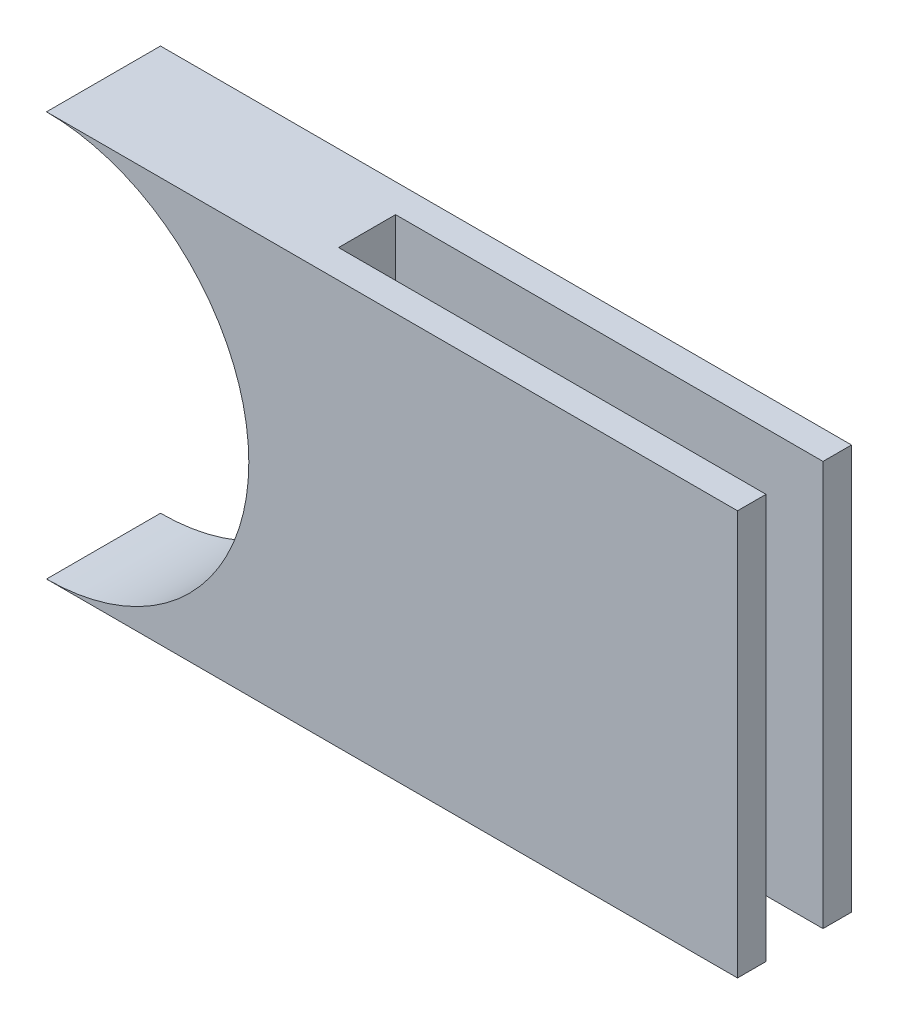
from build123d import *

# Parameters (mm, degrees)
SKETCH1_R               = 19.939
CIRCLE_EXTRUDE_DEPTH    = 7.62
SKETCH3_W               = 7.62
SKETCH3_H               = 39.878
RECTANGLE_EXTRUDE_DEPTH = 63.5
SKETCH2_R               = 18.034
CRICLE_CUT_DEPTH        = 67.991627245
SKETCH4_OUTSIDE_W       = 103.997
SKETCH4_OUTSIDE_H       = 60.436
SKETCH4_OUTSIDE_W_2     = 61.595
SKETCH4_OUTSIDE_H_2     = 36.068
FRAME_CUT_DEPTH         = 67.991627245
EXTENSION_DEPTH         = 2.54
SKETCH13_W              = 5.08
SKETCH13_H              = 36.068
CUT_EXTRUDE1_DEPTH      = 38.1
SKETCH14_R              = 1.905
BOSS_EXTRUDE3_DEPTH     = 2.54


with BuildPart() as part:
    # Sketch1 → circle extrude (new body)
    with BuildSketch(Plane.XY):
        Circle(SKETCH1_R)
    extrude(amount=CIRCLE_EXTRUDE_DEPTH)

    # Sketch3 → rectangle extrude (add)
    with BuildSketch(Plane(origin=(0, 0, 0), x_dir=(0, 0, -1), z_dir=(1, 0, 0))):
        with Locations((-3.81, 0)):
            Rectangle(SKETCH3_W, SKETCH3_H)
    extrude(amount=RECTANGLE_EXTRUDE_DEPTH)

    # Sketch2 → cricle cut (cut, through all)
    with BuildSketch(Plane.XY.offset(7.62)):
        Circle(SKETCH2_R)
    extrude(amount=-CRICLE_CUT_DEPTH, mode=Mode.SUBTRACT)

    # Sketch4 outside → frame cut (cut, through all)
    with BuildSketch(Plane.XY.offset(7.62)):
        with Locations((21.7805, 0)):
            Rectangle(SKETCH4_OUTSIDE_W, SKETCH4_OUTSIDE_H)
        with Locations((30.7975, 0)):
            Rectangle(SKETCH4_OUTSIDE_W_2, SKETCH4_OUTSIDE_H_2, mode=Mode.SUBTRACT)
    extrude(amount=-FRAME_CUT_DEPTH, mode=Mode.SUBTRACT)

    # Sketch10 → extension (add)
    with BuildSketch(Plane(origin=(0, 0, 0), x_dir=(-1, 0, 0), z_dir=(0, 0, -1))):
        with BuildLine():
            Line((0, 18.034), (-61.595, 18.034))
            Line((-61.595, 18.034), (-61.595, -18.034))
            Line((-61.595, -18.034), (0, -18.034))
            ThreePointArc((0, -18.034), (-18.034, 0), (0, 18.034))
        make_face()
    extrude(amount=EXTENSION_DEPTH)

    # Sketch13 → Cut-Extrude1 (cut)
    with BuildSketch(Plane(origin=(61.595, 0, 0), x_dir=(0, 0, -1), z_dir=(1, 0, 0))):
        with Locations((-2.54, 0)):
            Rectangle(SKETCH13_W, SKETCH13_H)
    extrude(amount=-CUT_EXTRUDE1_DEPTH, mode=Mode.SUBTRACT)

    # Sketch14 → Boss-Extrude3 (add)
    with BuildSketch(Plane(origin=(23.495, 0, 0), x_dir=(0, 0, -1), z_dir=(1, 0, 0))):
        with Locations((-2.54, 0)):
            Circle(SKETCH14_R)
    extrude(amount=BOSS_EXTRUDE3_DEPTH)


solid = part.part
